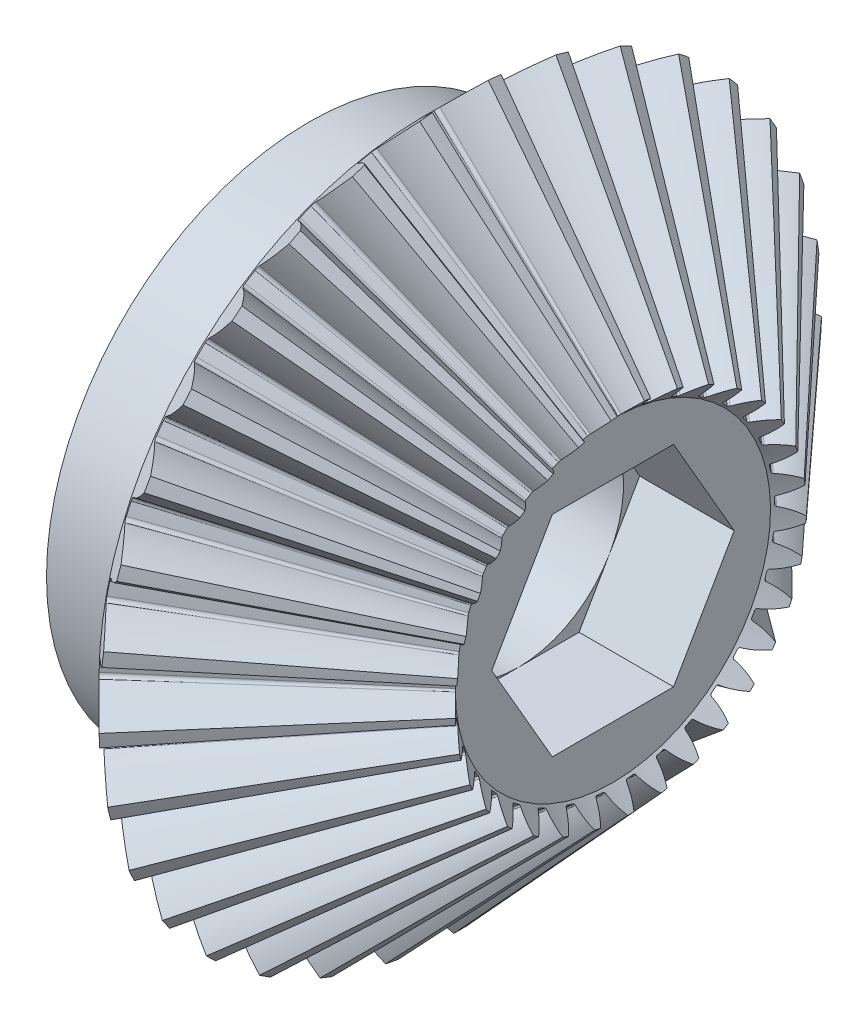
from build123d import *

# Parameters (mm, degrees)
TEETHCUTS_COUNT       = 33
TEETHCUTS_ANGLE       = 349.090909091
HUBSKE_R              = 12.5
HUB_DEPTH             = 5.449164146
BORSKE_R              = 2.5
BORE_DEPTH            = 23.0000508
CORTAR_EXTRUIR1_DEPTH = 4.5
CROQUIS2_R            = 5
CORTAR_EXTRUIR2_DEPTH = 14.5


with BuildPart() as part:
    # BasProSke → Base-Revolve (revolve)
    with BuildSketch(Plane(origin=(0, 0, 0), x_dir=(1, 0, 0), z_dir=(0, 1, 0)), mode=Mode.PRIVATE) as base_revolve_sk:
        Polygon((0, 0), (0, 15.449062547), (1.758044236, 17.207106781), (9.879689239, 8.358189035), (9.025735913, 7.504235711), (9.025735913, 0), align=None)
    revolve(base_revolve_sk.sketch.rotate(Axis((-10, 0, 0), (1, 0, 0)), 180), axis=Axis((-10, 0, 0), (1, 0, 0)))

    # ToothCut: read off the stored shape, not the designer's step
    # ToothCut: loft between two sections, ruled curve by curve
    toothcut_from = [
        Edge.make_bspline([(17.557371624, 0.006434169, -0.008859602), (17.552987386, 0.002049932, -0.015227606), (17.546735772, -0.004201682, -0.014317002), (17.543361398, -0.007576056, -0.006818885)], [0, 0, 0, 0, 1, 1, 1, 1], 3, [1, 0.74701913, 0.74701913, 1]),
        Edge.make_bspline([(17.543361398, -0.007576056, 0.006818885), (17.546735772, -0.004201682, 0.014317002), (17.552987386, 0.002049932, 0.015227606), (17.557371624, 0.006434169, 0.008859602)], [0, 0, 0, 0, 1, 1, 1, 1], 3, [1, 0.74701913, 0.74701913, 1]),
        Edge.make_bspline([(17.543361398, -0.007576056, -0.006818885), (17.542947276, -0.007990178, -0.005898674), (17.542619935, -0.008317519, -0.004911011), (17.542384772, -0.008552683, -0.003872176)], [0, 0, 0, 0, 1, 1, 1, 1], 3, [1, 0.994505488, 0.994505488, 1]),
        Edge.make_bspline([(17.542384772, -0.008552683, 0.003872176), (17.542619935, -0.008317519, 0.004911011), (17.542947276, -0.007990178, 0.005898674), (17.543361398, -0.007576056, 0.006818885)], [0, 0, 0, 0, 1, 1, 1, 1], 3, [1, 0.994505488, 0.994505488, 1]),
        Edge.make_bspline([(17.542384772, -0.008552683, -0.003872176), (17.541809982, -0.009127473, -0.00133304), (17.541809982, -0.009127473, 0.00133304), (17.542384772, -0.008552683, 0.003872176)], [0, 0, 0, 0, 1, 1, 1, 1], 3, [1, 0.968257159, 0.968257159, 1]),
        Edge.make_line((17.557371624, 0.006434169, 0.008859602), (17.557371624, 0.006434169, -0.008859602)),
    ]
    toothcut_to = [
        Edge.make_bspline([(1.957843945, 17.406906489, -1.550186802), (1.462436883, 16.911499428, -1.039232437), (0.9062007, 16.355263246, -0.674358083), (0.310395439, 15.759457986, -0.469509697)], [0, 0, 0, 0, 1, 1, 1, 1], 3, [1, 0.987259582, 0.987259582, 1]),
        Edge.make_bspline([(0.310395439, 15.759457986, 0.469509697), (0.9062007, 16.355263246, 0.674358083), (1.462436883, 16.911499428, 1.039232437), (1.957843945, 17.406906489, 1.550186802)], [0, 0, 0, 0, 1, 1, 1, 1], 3, [1, 0.987259582, 0.987259582, 1]),
        Edge.make_bspline([(0.310395439, 15.759457986, -0.469509697), (0.246991047, 15.696053594, -0.447710146), (0.207142743, 15.65620529, -0.374637034), (0.208346141, 15.657408688, -0.28237351)], [0, 0, 0, 0, 1, 1, 1, 1], 3, [1, 0.853648189, 0.853648189, 1]),
        Edge.make_bspline([(0.208346141, 15.657408688, 0.28237351), (0.207142743, 15.65620529, 0.374637034), (0.246991047, 15.696053594, 0.447710146), (0.310395439, 15.759457986, 0.469509697)], [0, 0, 0, 0, 1, 1, 1, 1], 3, [1, 0.853648189, 0.853648189, 1]),
        Edge.make_bspline([(0.208346141, 15.657408688, -0.28237351), (0.210801344, 15.659863891, -0.094135177), (0.210801344, 15.659863891, 0.094135177), (0.208346141, 15.657408688, 0.28237351)], [0, 0, 0, 0, 1, 1, 1, 1], 3, [1, 0.999886615, 0.999886615, 1]),
        Edge.make_line((1.957843945, 17.406906489, 1.550186802), (1.957843945, 17.406906489, -1.550186802)),
    ]
    toothcut = Solid(Shell([*[Face.make_surface_from_curves(toothcut_from[k], toothcut_to[k]) for k in range(6)], Face(Wire(toothcut_from)), Face(Wire(toothcut_to))]))
    add(toothcut, mode=Mode.SUBTRACT)

    # TeethCuts: ToothCut ×33 about axis
    teethcuts_axis = Axis((-10, 0, 0), (1, 0, 0))
    for i in range(1, TEETHCUTS_COUNT):
        add(toothcut.rotate(teethcuts_axis, i * TEETHCUTS_ANGLE / (TEETHCUTS_COUNT - 1)), mode=Mode.SUBTRACT)

    # HubSke → Hub (add)
    with BuildSketch(Plane.ZY):
        with Locations(Location((0, 0, 0), (0, 0, 180))):
            Circle(HUBSKE_R)
    extrude(amount=HUB_DEPTH)

    # BorSke → Bore (cut, symmetric)
    with BuildSketch(Plane(origin=(0, 0, 0), x_dir=(0, 0, -1), z_dir=(1, 0, 0))):
        with Locations(Location((0, 0, 0), (0, 0, 180))):
            Circle(BORSKE_R)
    extrude(amount=BORE_DEPTH, both=True, mode=Mode.SUBTRACT)

    # Croquis1 → Cortar-Extruir1 (cut)
    with BuildSketch(Plane(origin=(9.025735913, 0, 0), x_dir=(0, 0, -1), z_dir=(1, 0, 0))):
        Polygon((-5.773502692, 0), (-2.886751346, -5), (2.886751346, -5), (5.773502692, 0), (2.886751346, 5), (-2.886751346, 5), align=None)
    extrude(amount=-CORTAR_EXTRUIR1_DEPTH, mode=Mode.SUBTRACT)

    # Croquis2 → Cortar-Extruir2 (cut)
    with BuildSketch(Plane(origin=(4.525735913, 0, 0), x_dir=(0, 0, -1), z_dir=(1, 0, 0))):
        with Locations(Location((0, 0, 0), (0, 0, 30))):
            Circle(CROQUIS2_R)
    extrude(amount=-CORTAR_EXTRUIR2_DEPTH, mode=Mode.SUBTRACT)


solid = part.part
